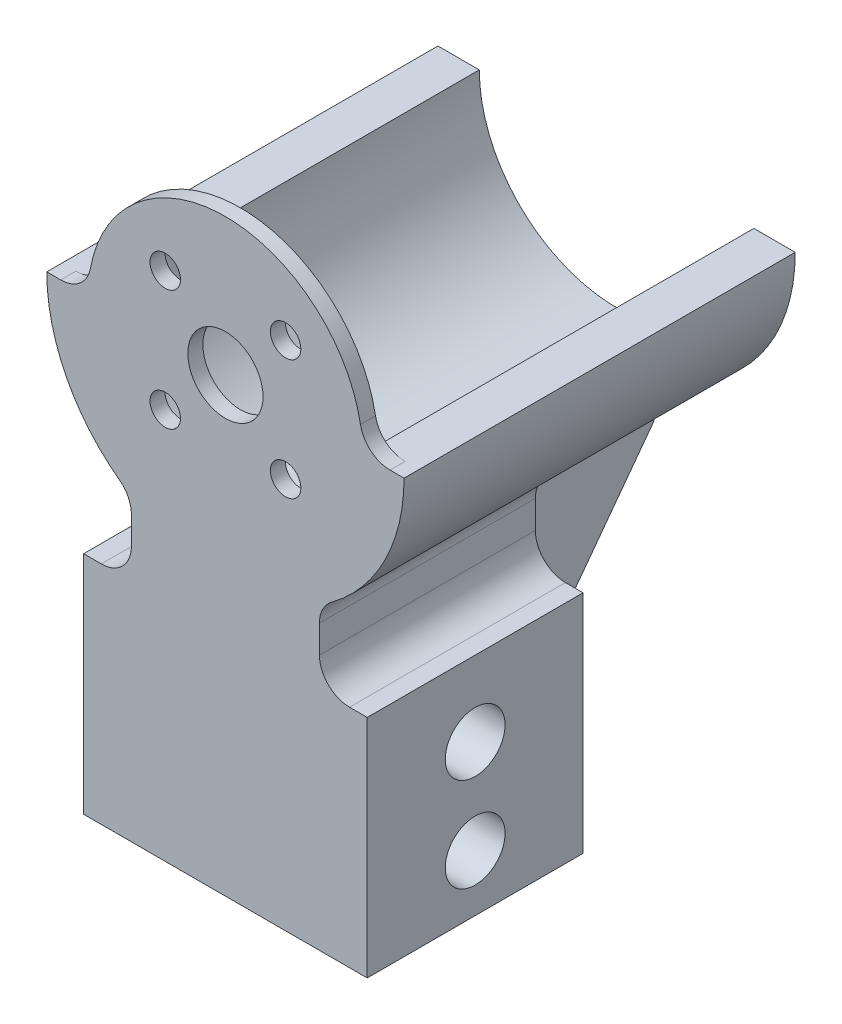
from build123d import *

# Parameters (mm, degrees)
SKETCH2_R               = 2.025
SKETCH2_R_2             = 5
BOSS_EXTRUDE3_DEPTH     = 2
BOSS_EXTRUDE4_START     = -50
BOSS_EXTRUDE4_DEPTH     = 52
BOSS_EXTRUDE6_START     = -30
SKETCH7_W               = 37.7
SKETCH7_H               = 28.7
SKETCH7_R               = 9.4
BOSS_EXTRUDE6_DEPTH     = 30
BOSS_EXTRUDE7_START     = -26.7
BOSS_EXTRUDE7_DEPTH     = 26.7
CUT_EXTRUDE1_DEPTH      = 82.633709336
CUT_EXTRUDE1_DEPTH_BACK = 82.633709336
SKETCH6_R               = 3.975
RIB3_START              = -5
RIB3_DEPTH              = 10
FILLET2_R               = 4


# Read off the part's stored shape, not the designer's step: Rib3
with BuildPart() as part:
    # Sketch2 → Boss-Extrude3 (new body)
    with BuildSketch(Plane.XY):
        with BuildLine():
            Line((12.5, -30), (12.5, -13.297086147))
            ThreePointArc((12.5, -13.297086147), (0, 18.25), (-12.5, -13.297086147))
            Line((-12.5, -13.297086147), (-12.5, -30))
            Line((-12.5, -30), (12.5, -30))
        make_face()
        with Locations((8, 8)):
            Circle(SKETCH2_R, mode=Mode.SUBTRACT)
        with Locations((-8, -8)):
            Circle(SKETCH2_R, mode=Mode.SUBTRACT)
        with Locations((-8, 8)):
            Circle(SKETCH2_R, mode=Mode.SUBTRACT)
        with Locations((8, -8)):
            Circle(SKETCH2_R, mode=Mode.SUBTRACT)
        Circle(SKETCH2_R_2, mode=Mode.SUBTRACT)
    extrude(amount=BOSS_EXTRUDE3_DEPTH)

    # Sketch3 → Boss-Extrude4 (add)
    with BuildSketch(Plane.XY.offset(BOSS_EXTRUDE4_START)):
        with BuildLine():
            Line((23.75, 0), (18.25, 0))
            ThreePointArc((18.25, 0), (0, -18.25), (-18.25, 0))
            Line((-18.25, 0), (-23.75, 0))
            ThreePointArc((-23.75, 0), (0, -23.75), (23.75, 0))
        make_face()
    extrude(amount=BOSS_EXTRUDE4_DEPTH)

    # Sketch7 → Boss-Extrude6 (add)
    with BuildSketch(Plane(origin=(0, 0, 0), x_dir=(1, 0, 0), z_dir=(0, 1, 0)).offset(BOSS_EXTRUDE6_START)):
        with Locations((0, 12.35)):
            Rectangle(SKETCH7_W, SKETCH7_H)
        with Locations(Location((0, 12.35, 0), (0, 0, 180))):
            Circle(SKETCH7_R, mode=Mode.SUBTRACT)
    extrude(amount=-BOSS_EXTRUDE6_DEPTH)

    # Sketch2<8> → Boss-Extrude7 (add)
    with BuildSketch(Plane.XY.offset(BOSS_EXTRUDE7_START)):
        with BuildLine():
            Line((12.5, -30), (12.5, -13.297086147))
            ThreePointArc((12.5, -13.297086147), (0, -18.25), (-12.5, -13.297086147))
            Line((-12.5, -13.297086147), (-12.5, -30))
            Line((-12.5, -30), (12.5, -30))
        make_face()
    extrude(amount=BOSS_EXTRUDE7_DEPTH)

    # Sketch6 → Cut-Extrude1 (cut, two sides: drawn at the far end of the back side and taken through both)
    with BuildSketch(Plane(origin=(0, 0, 0), x_dir=(0, 0, -1), z_dir=(1, 0, 0)).offset(-CUT_EXTRUDE1_DEPTH_BACK)):
        with Locations((12.35, -40)):
            Circle(SKETCH6_R)
        with Locations((12.35, -52.5)):
            Circle(SKETCH6_R)
    extrude(amount=CUT_EXTRUDE1_DEPTH + CUT_EXTRUDE1_DEPTH_BACK, mode=Mode.SUBTRACT)

    # Rib3 outline → Rib3 (add)
    with BuildSketch(Plane(origin=(0, -60, 0), x_dir=(0, -1, 0), z_dir=(-1, 0, 0)).offset(RIB3_START)):
        Polygon((-38, -50), (-31.25, -50), (0, -26.7), (-38, -26.7), align=None)
    extrude(amount=RIB3_DEPTH)

    # Fillet2
    fillet2_edges = [part.edges().sort_by_distance(p)[0] for p in [
        (12.5, -30, -12.35),
        (-12.5, -30, -12.35),
        (-18.25, 0, 1),
        (12.5, -20.194368027, -12.35),
        (18.25, 0, 1),
        (-12.5, -20.194368027, -12.35),
    ]]
    fillet(fillet2_edges, radius=FILLET2_R)


solid = part.part
